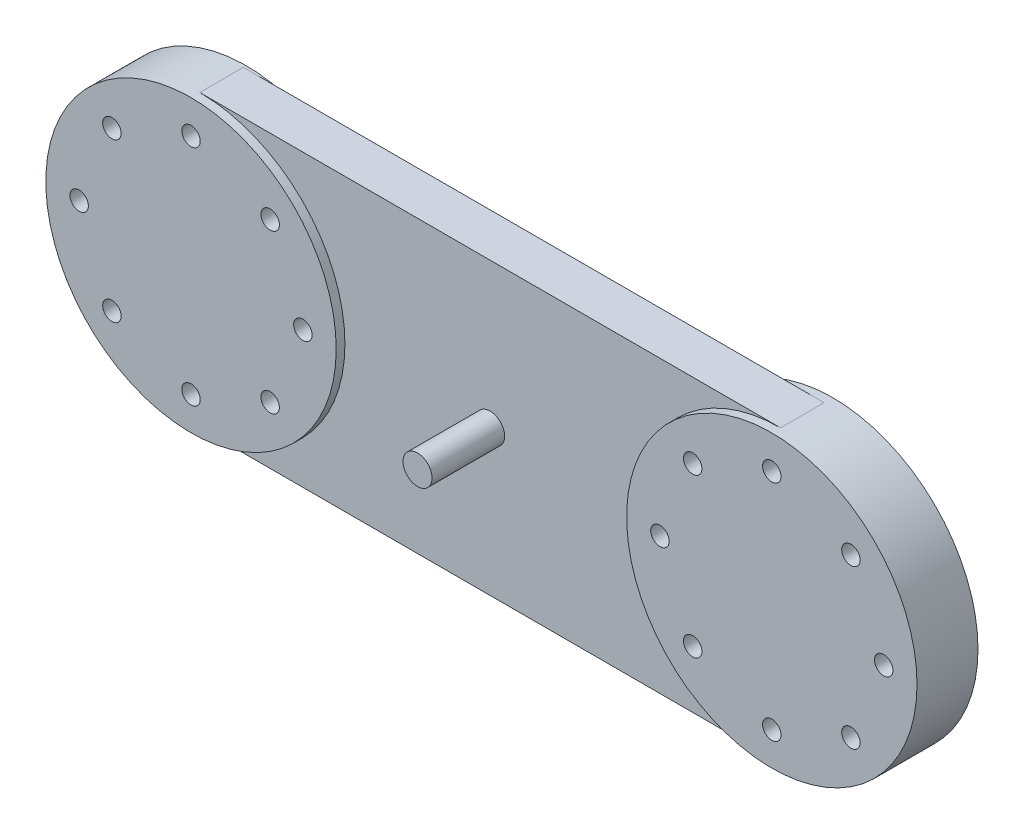
from build123d import *

# Parameters (mm, degrees)
SKETCH_1_R               = 50
EXTRUDE_18_DEPTH         = 13
EXTRUDE_18_2_DEPTH       = 13
SKETCH_1_28_W            = 200
SKETCH_1_28_H            = 100
EXTRUDE_21_DEPTH         = 15
SKETCH_1_30_R            = 5
EXTRUDE_22_DEPTH         = 40
SKETCH_1_31_R            = 50
CUT_EXTRUDE_2_DEPTH      = 41
EXTRUDE_23_DEPTH         = 18
EXTRUDE_23_DEPTH_BACK    = 1
SKETCH_1_32_R            = 50
SKETCH_1_33_R            = 6.5
CUT_EXTRUDE_3_DEPTH      = 242.8
SKETCH_1_34_R            = 3.175
CUT_EXTRUDE_4_DEPTH      = 78
CUT_EXTRUDE_5_DEPTH      = 130
CUT_EXTRUDE_5_DEPTH_BACK = 69
SKETCH_1_35_R            = 3.175
SKETCH_1_36_R            = 50
CUT_EXTRUDE_6_DEPTH      = 34
EXTRUDE_24_DEPTH         = 18
EXTRUDE_24_DEPTH_BACK    = 3
SKETCH_1_37_R            = 50
CUT_EXTRUDE_7_DEPTH      = 136
CUT_EXTRUDE_7_DEPTH_BACK = 164
SKETCH_1_39_R            = 3.175
CUT_EXTRUDE_9_DEPTH      = 116
CUT_EXTRUDE_9_DEPTH_BACK = 90
SKETCH_1_40_R            = 3.175


with BuildPart() as part:
    # 草图1 → 凸台-拉伸18 (new body)
    with BuildSketch(Plane.XY):
        with Locations((0, 50)):
            Circle(SKETCH_1_R)
    extrude(amount=EXTRUDE_18_DEPTH)



with BuildPart() as body_2:
    # 草图1 → Extrude 18 2 (new body)
    with BuildSketch(Plane.XY):
        with Locations((-200, 50)):
            Circle(SKETCH_1_R)
    extrude(amount=EXTRUDE_18_2_DEPTH)


with BuildPart() as part_1:
    add(part.part)

    add(body_2.part)  # 凸台-拉伸21 merges body 2
    # 草图1<28> → 凸台-拉伸21 (add)
    with BuildSketch(Plane.XY):
        with Locations((-100, 50)):
            Rectangle(SKETCH_1_28_W, SKETCH_1_28_H)
    extrude(amount=EXTRUDE_21_DEPTH)

    # 草图1<30> → 凸台-拉伸22 (add)
    with BuildSketch(Plane.XY):
        with Locations((-100, 50)):
            Circle(SKETCH_1_30_R)
    extrude(amount=EXTRUDE_22_DEPTH)

    # 草图1<31> → 切除-拉伸2 (cut)
    with BuildSketch(Plane.XY):
        with Locations((-200, 50)):
            Circle(SKETCH_1_31_R)
    extrude(amount=CUT_EXTRUDE_2_DEPTH, mode=Mode.SUBTRACT)

    # 草图1<32> → 凸台-拉伸23 (add, two sides: drawn at the far end of the back side and taken through both)
    with BuildSketch(Plane.XY.offset(-EXTRUDE_23_DEPTH_BACK)):
        with Locations((-200, 50)):
            Circle(SKETCH_1_32_R)
    extrude(amount=EXTRUDE_23_DEPTH + EXTRUDE_23_DEPTH_BACK)

    # 草图1<33> → 切除-拉伸3 (cut)
    with BuildSketch(Plane.XY):
        with Locations((0, 50)):
            Circle(SKETCH_1_33_R)
    extrude(amount=CUT_EXTRUDE_3_DEPTH, mode=Mode.SUBTRACT)

    # 草图1<34> → 切除-拉伸4 (cut)
    with BuildSketch(Plane.XY):
        with Locations((-238.530339059, 50)):
            Circle(SKETCH_1_34_R)
    extrude(amount=CUT_EXTRUDE_4_DEPTH, mode=Mode.SUBTRACT)

    # 草图1<35> → 切除-拉伸5 (cut, two sides: drawn at the far end of the back side and taken through both)
    with BuildSketch(Plane.XY.offset(-CUT_EXTRUDE_5_DEPTH_BACK)):
        with Locations((-161.469660941, 50)):
            Circle(SKETCH_1_35_R)
        with Locations((-172.75493597, 22.75493597)):
            Circle(SKETCH_1_35_R)
        with Locations((-200, 11.469660941)):
            Circle(SKETCH_1_35_R)
        with Locations((-227.24506403, 22.75493597)):
            Circle(SKETCH_1_35_R)
        with Locations((-227.24506403, 77.24506403)):
            Circle(SKETCH_1_35_R)
        with Locations((-200, 88.530339059)):
            Circle(SKETCH_1_35_R)
        with Locations((-172.75493597, 77.24506403)):
            Circle(SKETCH_1_35_R)
    extrude(amount=CUT_EXTRUDE_5_DEPTH + CUT_EXTRUDE_5_DEPTH_BACK, mode=Mode.SUBTRACT)

    # 草图1<36> → 切除-拉伸6 (cut)
    with BuildSketch(Plane.XY):
        with Locations((0, 50)):
            Circle(SKETCH_1_36_R)
    extrude(amount=CUT_EXTRUDE_6_DEPTH, mode=Mode.SUBTRACT)

    # 草图1<37> → 凸台-拉伸24 (add, two sides: drawn at the far end of the back side and taken through both)
    with BuildSketch(Plane.XY.offset(-EXTRUDE_24_DEPTH_BACK)):
        with Locations((0, 50)):
            Circle(SKETCH_1_37_R)
    extrude(amount=EXTRUDE_24_DEPTH + EXTRUDE_24_DEPTH_BACK)

    # 草图1<39> → 切除-拉伸7 (cut, two sides: drawn at the far end of the back side and taken through both)
    with BuildSketch(Plane.XY.offset(-CUT_EXTRUDE_7_DEPTH_BACK)):
        with Locations((-27.24506403, 77.24506403)):
            Circle(SKETCH_1_39_R)
        with Locations((-38.530339059, 50)):
            Circle(SKETCH_1_39_R)
        with Locations((-27.24506403, 22.75493597)):
            Circle(SKETCH_1_39_R)
        with Locations((0, 11.469660941)):
            Circle(SKETCH_1_39_R)
        with Locations((27.24506403, 22.75493597)):
            Circle(SKETCH_1_39_R)
        with Locations((38.530339059, 50)):
            Circle(SKETCH_1_39_R)
        with Locations((27.24506403, 77.24506403)):
            Circle(SKETCH_1_39_R)
        with Locations((0, 88.530339059)):
            Circle(SKETCH_1_39_R)
    extrude(amount=CUT_EXTRUDE_7_DEPTH + CUT_EXTRUDE_7_DEPTH_BACK, mode=Mode.SUBTRACT)

    # 草图1<40> → 切除-拉伸9 (cut, two sides: drawn at the far end of the back side and taken through both)
    with BuildSketch(Plane.XY.offset(-CUT_EXTRUDE_9_DEPTH_BACK)):
        with Locations((-238.530339059, 50)):
            Circle(SKETCH_1_40_R)
    extrude(amount=CUT_EXTRUDE_9_DEPTH + CUT_EXTRUDE_9_DEPTH_BACK, mode=Mode.SUBTRACT)


solid = part_1.part
